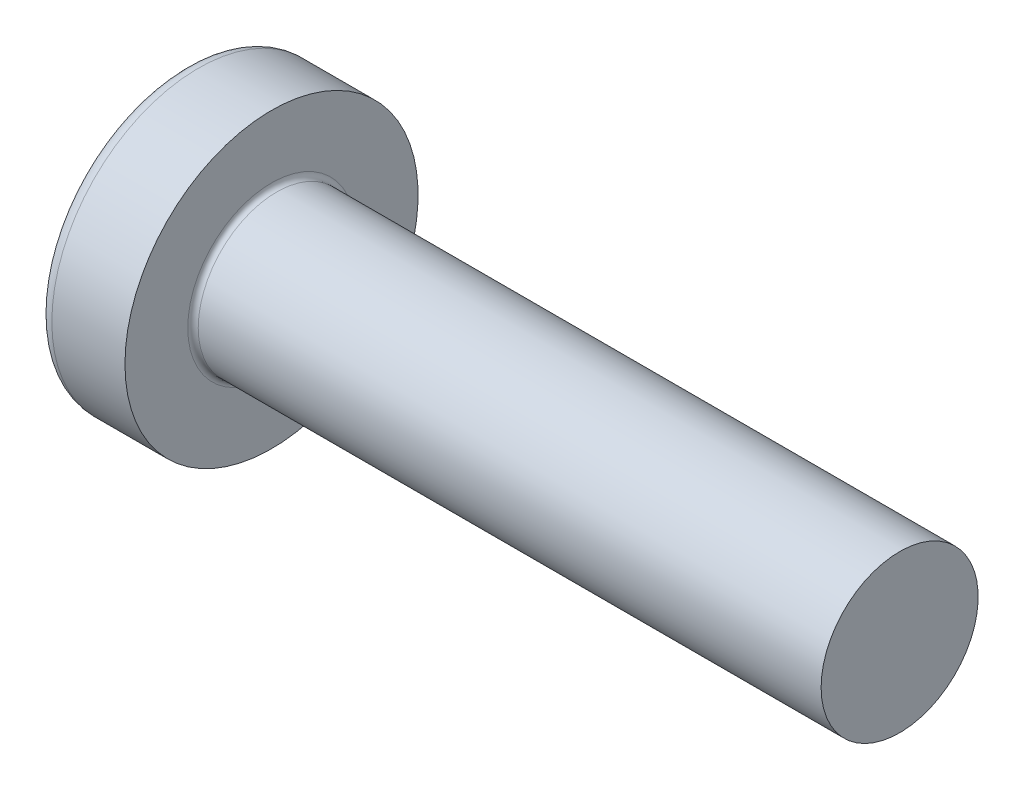
from build123d import *

# Parameters (mm, degrees)
RECPAT_COUNT = 2
RECPAT_ANGLE = 90


with BuildPart() as part:
    # Fillet1: read off the stored shape, not the designer's step
    # Fillet1 outline → Fillet1 (revolve)
    with BuildSketch(Plane.YX):
        with BuildLine():
            Line((1.5, 2.5), (1.5, 14.4))
            Line((1.5, 14.4), (0, 14.4))
            Line((0, 14.4), (0, 0))
            ThreePointArc((0, 0), (1.392274758, 0.197753547), (2.674418607, 0.775371601))
            ThreePointArc((2.674418607, 0.775371601), (2.76653015, 0.873295971), (2.8, 1.003501533))
            Line((2.8, 1.003501533), (2.8, 2.4))
            Line((2.8, 2.4), (1.6, 2.4))
            ThreePointArc((1.6, 2.4), (1.529289322, 2.429289322), (1.5, 2.5))
        make_face()
    revolve(axis=Axis((0, 0, 0), (1, 0, 0)))

    # Sketch3 → Recess section 0
    with BuildSketch(Plane(origin=(0, 0, 0), x_dir=(0, 0, -1), z_dir=(1, 0, 0))):
        with BuildLine():
            Line((0.37, -1.4), (-0.37, -1.4))
            Line((-0.37, -1.4), (-0.37, 1.4))
            Line((-0.37, 1.4), (0.37, 1.4))
            Line((0.37, 1.4), (0.37, -1.4))
        make_face()
    # Sketch4 → Recess section 1
    with BuildSketch(Plane(origin=(1.75, 0, 0), x_dir=(0, 0, -1), z_dir=(1, 0, 0))):
        with BuildLine():
            Line((0.37, -0.527482332), (-0.37, -0.527482332))
            Line((-0.37, -0.527482332), (-0.37, 0.527482332))
            Line((-0.37, 0.527482332), (0.37, 0.527482332))
            Line((0.37, 0.527482332), (0.37, -0.527482332))
        make_face()
    recess = loft(mode=Mode.SUBTRACT)

    # RecPat: Recess ×2 about axis
    recpat_axis = Axis((0, 0, 0), (1, 0, 0))
    for i in range(1, RECPAT_COUNT):
        add(recess.rotate(recpat_axis, i * RECPAT_ANGLE / (RECPAT_COUNT - 1)), mode=Mode.SUBTRACT)

    # RecCorSke → RecessCore (revolve, cut)
    with BuildSketch(Plane.XY, mode=Mode.PRIVATE) as recesscore_sk:
        Polygon((0, 0), (0, 0.678371921), (1.75, 0.556), (1.930655351, 0), align=None)
    revolve(recesscore_sk.sketch.rotate(Axis((-3.175, 0, 0), (1, 0, 0)), 90), axis=Axis((-3.175, 0, 0), (1, 0, 0)), mode=Mode.SUBTRACT)


solid = part.part
